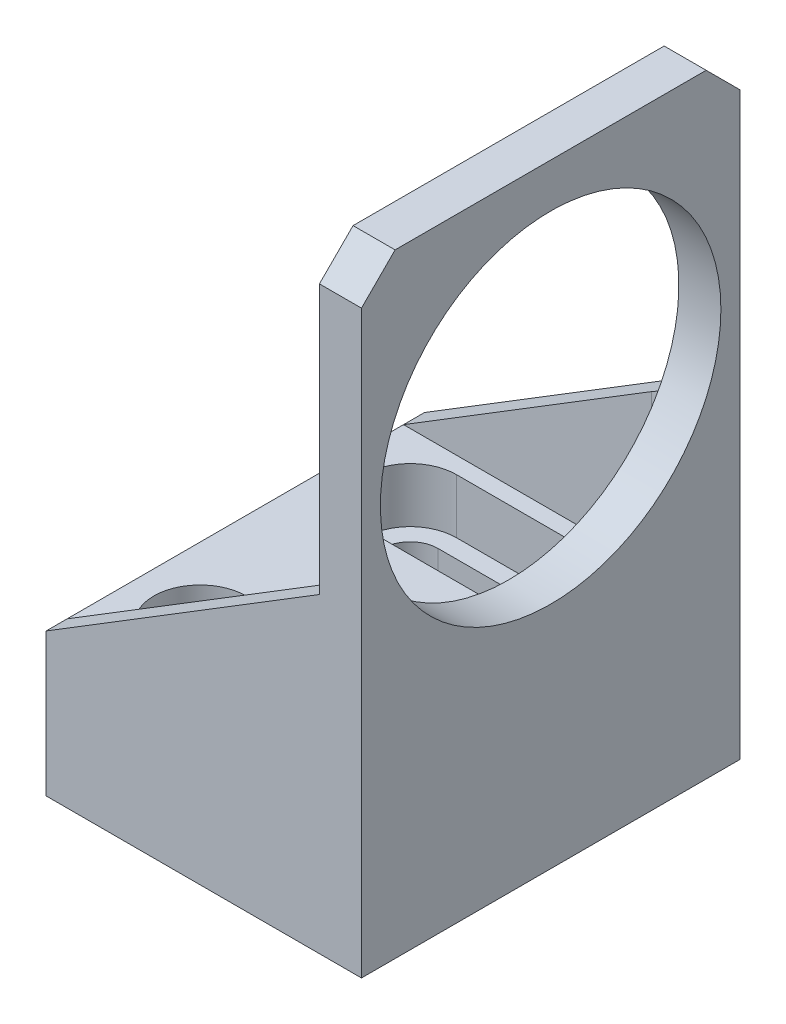
from build123d import *

# Parameters (mm, degrees)
SKETCH1_W                                      = 45
SKETCH1_H                                      = 73
SKETCH1_R                                      = 20.25
BOSS_EXTRUDE1_DEPTH                            = 5
CHAMFER1_SIZE                                  = 4
SKETCH2_W                                      = 45
SKETCH2_H                                      = 17
BOSS_EXTRUDE2_DEPTH                            = 32.5
CBORE_SLOT_FOR_M6_HEX_SOCKET_HEAD_CAP_SC_DEPTH = 17
CBORE_START                                    = 10.5
CBORE_SLOT_FOR_M6_HEX_SOCKET_HEAD_CA_3_DEPTH   = 6.5
BOSS_EXTRUDE3_DEPTH                            = 2.5
FILLET1_R                                      = 3
FILLET1_OF_MIRROR1_R                           = 3


# Read off the part's stored shape, not the designer's step: CBORE SLOT for M6 Hex Socket Head Cap Screw1
with BuildPart() as part:
    # Sketch1 → Boss-Extrude1 (new body)
    with BuildSketch(Plane(origin=(0, 0, 0), x_dir=(0, 0, -1), z_dir=(1, 0, 0))):
        with Locations((0, 36.5)):
            Rectangle(SKETCH1_W, SKETCH1_H)
        with Locations((0, 47.5)):
            Circle(SKETCH1_R, mode=Mode.SUBTRACT)
    extrude(amount=BOSS_EXTRUDE1_DEPTH)

    # Chamfer1
    chamfer1_edges = [part.edges().sort_by_distance(p)[0] for p in [
        (2.5, 73, 22.5),
        (2.5, 73, -22.5),
    ]]
    chamfer(chamfer1_edges, length=CHAMFER1_SIZE)

    # Sketch2 → Boss-Extrude2 (add)
    with BuildSketch(Plane.ZY):
        with Locations((0, 8.5)):
            Rectangle(SKETCH2_W, SKETCH2_H)
    extrude(amount=BOSS_EXTRUDE2_DEPTH)

    # CBORE SLOT for M6 Hex Socket Head Ca 2 → CBORE SLOT for M6 Hex Socket Head Cap Screw1 (cut)
    with BuildSketch(Plane(origin=(0, 0, 0), x_dir=(1, 0, 0), z_dir=(0, 1, 0))):
        with BuildLine():
            Line((-24.2, -15.8), (-5.8, -15.8))
            ThreePointArc((-5.8, -15.8), (-2.5, -12.5), (-5.8, -9.2))
            Line((-5.8, -9.2), (-24.2, -9.2))
            ThreePointArc((-24.2, -9.2), (-27.5, -12.5), (-24.2, -15.8))
        make_face()
        with BuildLine():
            Line((-24.2, 9.2), (-5.8, 9.2))
            ThreePointArc((-5.8, 9.2), (-2.5, 12.5), (-5.8, 15.8))
            Line((-5.8, 15.8), (-24.2, 15.8))
            ThreePointArc((-24.2, 15.8), (-27.5, 12.5), (-24.2, 9.2))
        make_face()
    extrude(amount=CBORE_SLOT_FOR_M6_HEX_SOCKET_HEAD_CAP_SC_DEPTH, mode=Mode.SUBTRACT)

    # CBORE SLOT for M6 Hex Socket Head Ca 3 o → CBORE SLOT for M6 Hex Socket Head Ca 3 (cut)
    # profile 1 of 2: a face of its own
    with BuildSketch(Plane(origin=(0, 0, 0), x_dir=(1, 0, 0), z_dir=(0, 1, 0)).offset(CBORE_START)):
        with BuildLine():
            Line((-24.2, -18), (-5.8, -18))
            ThreePointArc((-5.8, -18), (-0.3, -12.5), (-5.8, -7))
            Line((-5.8, -7), (-24.2, -7))
            ThreePointArc((-24.2, -7), (-29.7, -12.5), (-24.2, -18))
        make_face()
        with BuildLine():
            ThreePointArc((-5.8, -9.2), (-2.5, -12.5), (-5.8, -15.8))
            Line((-5.8, -15.8), (-24.2, -15.8))
            ThreePointArc((-24.2, -15.8), (-27.5, -12.5), (-24.2, -9.2))
            Line((-24.2, -9.2), (-5.8, -9.2))
        make_face(mode=Mode.SUBTRACT)
    # profile 2 of 2: a face of its own
    with BuildSketch(Plane(origin=(0, 0, 0), x_dir=(1, 0, 0), z_dir=(0, 1, 0)).offset(CBORE_START)):
        with BuildLine():
            Line((-24.2, 7), (-5.8, 7))
            ThreePointArc((-5.8, 7), (-0.3, 12.5), (-5.8, 18))
            Line((-5.8, 18), (-24.2, 18))
            ThreePointArc((-24.2, 18), (-29.7, 12.5), (-24.2, 7))
        make_face()
        with BuildLine():
            ThreePointArc((-5.8, 15.8), (-2.5, 12.5), (-5.8, 9.2))
            Line((-5.8, 9.2), (-24.2, 9.2))
            ThreePointArc((-24.2, 9.2), (-27.5, 12.5), (-24.2, 15.8))
            Line((-24.2, 15.8), (-5.8, 15.8))
        make_face(mode=Mode.SUBTRACT)
    extrude(amount=CBORE_SLOT_FOR_M6_HEX_SOCKET_HEAD_CA_3_DEPTH, mode=Mode.SUBTRACT)

    # Sketch5 → Boss-Extrude3 (add)
    with BuildSketch(Plane.XY.offset(22.5)):
        Polygon((0, 37), (-32.5, 17), (0, 17), align=None)
    boss_extrude3 = extrude(amount=-BOSS_EXTRUDE3_DEPTH)

    # Fillet1
    # the kernel refuses this fillet: 3 mm, written as the material it adds along each edge
    with BuildSketch(Plane(origin=(0, 9.5, 20), x_dir=(0, 0, -1), z_dir=(0, 1, 0))) as fillet1_piece_1_section:
        with BuildLine():
            CenterArc((FILLET1_R, FILLET1_R), FILLET1_R, 180, 90)
            Line((0, FILLET1_R), (0, 0))
            Line((0, 0), (FILLET1_R, 0))
        make_face()
    fillet1_piece_1 = extrude(amount=35, mode=Mode.PRIVATE)
    fillet1_piece_1 = split(fillet1_piece_1, bisect_by=Plane(origin=(-11.093486365, 30.17323916, 19.320814657), z_dir=(0.5240974256643348, -0.8516583167045438, 0)), keep=Keep.TOP, mode=Mode.PRIVATE)
    fillet1_piece_1 = fillet1_piece_1 - Plane(origin=(-0.679185343, 47.5, 0), x_dir=(0, 0, -1), z_dir=(-1, 0, 0)) * Cylinder(20.25, 83, mode=Mode.PRIVATE)
    add(fillet1_piece_1)

    # Mirror1: Boss-Extrude3 across plane
    add(boss_extrude3.mirror(Plane.XY))

    # Fillet1 of Mirror1
    # the kernel refuses this fillet: 3 mm, written as the material it adds along each edge
    with BuildSketch(Plane(origin=(0, 9.5, -20), x_dir=(0, 0, 1), z_dir=(0, 1, 0))) as fillet1_of_mirror1_piece_1_section:
        with BuildLine():
            CenterArc((FILLET1_OF_MIRROR1_R, -FILLET1_OF_MIRROR1_R), FILLET1_OF_MIRROR1_R, 90, 90)
            Line((0, -FILLET1_OF_MIRROR1_R), (0, 0))
            Line((0, 0), (FILLET1_OF_MIRROR1_R, 0))
        make_face()
    fillet1_of_mirror1_piece_1 = extrude(amount=35, mode=Mode.PRIVATE)
    fillet1_of_mirror1_piece_1 = fillet1_of_mirror1_piece_1 - Plane(origin=(-0.679185343, 47.5, 0), x_dir=(0, 0, -1), z_dir=(-1, 0, 0)) * Cylinder(20.25, 83, mode=Mode.PRIVATE)
    fillet1_of_mirror1_piece_1 = split(fillet1_of_mirror1_piece_1, bisect_by=Plane(origin=(-11.093486365, 30.17323916, -19.320814657), z_dir=(0.5240974256643348, -0.8516583167045438, 0)), keep=Keep.TOP, mode=Mode.PRIVATE)
    add(fillet1_of_mirror1_piece_1)


solid = part.part
